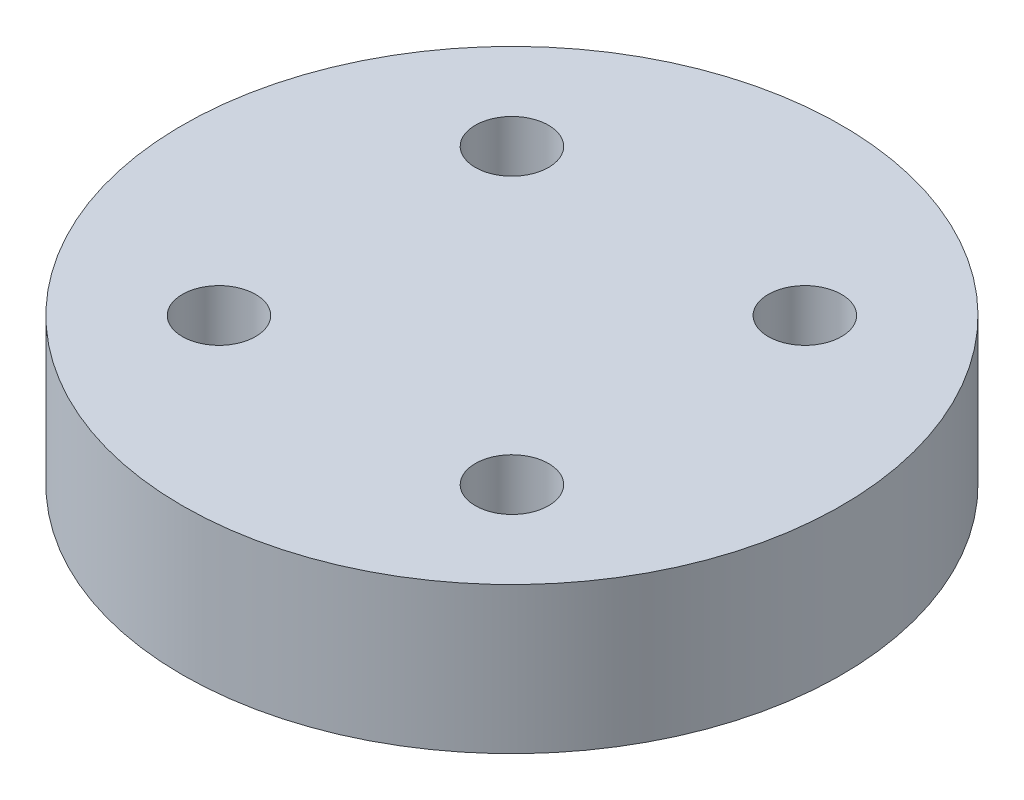
from build123d import *

# Parameters (mm, degrees)
SKETCH_1_R      = 9
SKETCH_1_R_2    = 1
EXTRUDE_1_DEPTH = 2


with BuildPart() as part:
    # 草圖1 → 填料-伸長1 (new, symmetric)
    with BuildSketch(Plane(origin=(0, 0, 0), x_dir=(1, 0, 0), z_dir=(0, 1, 0))):
        Circle(SKETCH_1_R)
        with Locations((-4, 4)):
            Circle(SKETCH_1_R_2, mode=Mode.SUBTRACT)
        with Locations((4, 4)):
            Circle(SKETCH_1_R_2, mode=Mode.SUBTRACT)
        with Locations((4, -4)):
            Circle(SKETCH_1_R_2, mode=Mode.SUBTRACT)
        with Locations((-4, -4)):
            Circle(SKETCH_1_R_2, mode=Mode.SUBTRACT)
    extrude(amount=EXTRUDE_1_DEPTH, both=True)


solid = part.part
